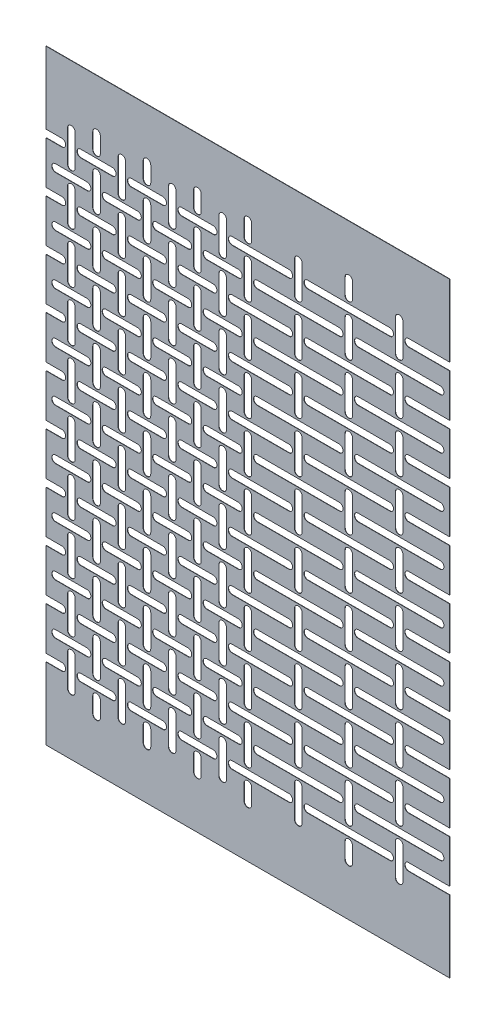
from build123d import *

# Parameters (mm, degrees)
BOSS_EXTRUDE1_DEPTH = 0.127


with BuildPart() as part:
    # Model → Boss-Extrude1 (new body)
    with BuildSketch(Plane.XY):
        with BuildLine():
            Line((0, 31.5), (6.25, 31.5))
            ThreePointArc((6.25, 31.5), (7.75, 30), (6.25, 28.5))
            Line((6.25, 28.5), (0, 28.5))
            Line((0, 28.5), (0, 0))
            Line((0, 0), (80, 0))
            Line((80, 0), (160, 0))
            Line((160, 0), (160, 28.5))
            Line((160, 28.5), (143.75, 28.5))
            ThreePointArc((143.75, 28.5), (142.25, 30), (143.75, 31.5))
            Line((143.75, 31.5), (160, 31.5))
            Line((160, 31.5), (160, 48.5))
            Line((160, 48.5), (143.75, 48.5))
            ThreePointArc((143.75, 48.5), (142.25, 50), (143.75, 51.5))
            Line((143.75, 51.5), (160, 51.5))
            Line((160, 51.5), (160, 68.5))
            Line((160, 68.5), (143.75, 68.5))
            ThreePointArc((143.75, 68.5), (142.25, 70), (143.75, 71.5))
            Line((143.75, 71.5), (160, 71.5))
            Line((160, 71.5), (160, 88.5))
            Line((160, 88.5), (143.75, 88.5))
            ThreePointArc((143.75, 88.5), (142.25, 90), (143.75, 91.5))
            Line((143.75, 91.5), (160, 91.5))
            Line((160, 91.5), (160, 108.5))
            Line((160, 108.5), (143.75, 108.5))
            ThreePointArc((143.75, 108.5), (142.25, 110), (143.75, 111.5))
            Line((143.75, 111.5), (160, 111.5))
            Line((160, 111.5), (160, 128.5))
            Line((160, 128.5), (143.75, 128.5))
            ThreePointArc((143.75, 128.5), (142.25, 130), (143.75, 131.5))
            Line((143.75, 131.5), (160, 131.5))
            Line((160, 131.5), (160, 148.5))
            Line((160, 148.5), (143.75, 148.5))
            ThreePointArc((143.75, 148.5), (142.25, 150), (143.75, 151.5))
            Line((143.75, 151.5), (160, 151.5))
            Line((160, 151.5), (160, 168.5))
            Line((160, 168.5), (143.75, 168.5))
            ThreePointArc((143.75, 168.5), (142.25, 170), (143.75, 171.5))
            Line((143.75, 171.5), (160, 171.5))
            Line((160, 171.5), (160, 188.5))
            Line((160, 188.5), (143.75, 188.5))
            ThreePointArc((143.75, 188.5), (142.25, 190), (143.75, 191.5))
            Line((143.75, 191.5), (160, 191.5))
            Line((160, 191.5), (160, 208.5))
            Line((160, 208.5), (143.75, 208.5))
            ThreePointArc((143.75, 208.5), (142.25, 210), (143.75, 211.5))
            Line((143.75, 211.5), (160, 211.5))
            Line((160, 211.5), (160, 240))
            Line((160, 240), (80, 240))
            Line((80, 240), (0, 240))
            Line((0, 240), (0, 211.5))
            Line((0, 211.5), (6.25, 211.5))
            ThreePointArc((6.25, 211.5), (7.75, 210), (6.25, 208.5))
            Line((6.25, 208.5), (0, 208.5))
            Line((0, 208.5), (0, 191.5))
            Line((0, 191.5), (6.25, 191.5))
            ThreePointArc((6.25, 191.5), (7.75, 190), (6.25, 188.5))
            Line((6.25, 188.5), (0, 188.5))
            Line((0, 188.5), (0, 171.5))
            Line((0, 171.5), (6.25, 171.5))
            ThreePointArc((6.25, 171.5), (7.75, 170), (6.25, 168.5))
            Line((6.25, 168.5), (0, 168.5))
            Line((0, 168.5), (0, 151.5))
            Line((0, 151.5), (6.25, 151.5))
            ThreePointArc((6.25, 151.5), (7.75, 150), (6.25, 148.5))
            Line((6.25, 148.5), (0, 148.5))
            Line((0, 148.5), (0, 131.5))
            Line((0, 131.5), (6.25, 131.5))
            ThreePointArc((6.25, 131.5), (7.75, 130), (6.25, 128.5))
            Line((6.25, 128.5), (0, 128.5))
            Line((0, 128.5), (0, 111.5))
            Line((0, 111.5), (6.25, 111.5))
            ThreePointArc((6.25, 111.5), (7.75, 110), (6.25, 108.5))
            Line((6.25, 108.5), (0, 108.5))
            Line((0, 108.5), (0, 91.5))
            Line((0, 91.5), (6.25, 91.5))
            ThreePointArc((6.25, 91.5), (7.75, 90), (6.25, 88.5))
            Line((6.25, 88.5), (0, 88.5))
            Line((0, 88.5), (0, 71.5))
            Line((0, 71.5), (6.25, 71.5))
            ThreePointArc((6.25, 71.5), (7.75, 70), (6.25, 68.5))
            Line((6.25, 68.5), (0, 68.5))
            Line((0, 68.5), (0, 51.5))
            Line((0, 51.5), (6.25, 51.5))
            ThreePointArc((6.25, 51.5), (7.75, 50), (6.25, 48.5))
            Line((6.25, 48.5), (0, 48.5))
            Line((0, 48.5), (0, 31.5))
        make_face()
        with BuildLine():
            Line((13.75, 31.5), (26.25, 31.5))
            ThreePointArc((26.25, 31.5), (27.75, 30), (26.25, 28.5))
            Line((26.25, 28.5), (13.75, 28.5))
            ThreePointArc((13.75, 28.5), (12.25, 30), (13.75, 31.5))
        make_face(mode=Mode.SUBTRACT)
        with BuildLine():
            Line((33.75, 31.5), (46.25, 31.5))
            ThreePointArc((46.25, 31.5), (47.75, 30), (46.25, 28.5))
            Line((46.25, 28.5), (33.75, 28.5))
            ThreePointArc((33.75, 28.5), (32.25, 30), (33.75, 31.5))
        make_face(mode=Mode.SUBTRACT)
        with BuildLine():
            Line((53.75, 31.5), (66.25, 31.5))
            ThreePointArc((66.25, 31.5), (67.75, 30), (66.25, 28.5))
            Line((66.25, 28.5), (53.75, 28.5))
            ThreePointArc((53.75, 28.5), (52.25, 30), (53.75, 31.5))
        make_face(mode=Mode.SUBTRACT)
        with BuildLine():
            Line((73.75, 31.5), (80, 31.5))
            Line((80, 31.5), (96.25, 31.5))
            ThreePointArc((96.25, 31.5), (97.75, 30), (96.25, 28.5))
            Line((96.25, 28.5), (80, 28.5))
            Line((80, 28.5), (73.75, 28.5))
            ThreePointArc((73.75, 28.5), (72.25, 30), (73.75, 31.5))
        make_face(mode=Mode.SUBTRACT)
        with BuildLine():
            Line((3.75, 41.5), (16.25, 41.5))
            ThreePointArc((16.25, 41.5), (17.75, 40), (16.25, 38.5))
            Line((16.25, 38.5), (3.75, 38.5))
            ThreePointArc((3.75, 38.5), (2.25, 40), (3.75, 41.5))
        make_face(mode=Mode.SUBTRACT)
        with BuildLine():
            Line((23.75, 41.5), (36.25, 41.5))
            ThreePointArc((36.25, 41.5), (37.75, 40), (36.25, 38.5))
            Line((36.25, 38.5), (23.75, 38.5))
            ThreePointArc((23.75, 38.5), (22.25, 40), (23.75, 41.5))
        make_face(mode=Mode.SUBTRACT)
        with BuildLine():
            Line((43.75, 41.5), (56.25, 41.5))
            ThreePointArc((56.25, 41.5), (57.75, 40), (56.25, 38.5))
            Line((56.25, 38.5), (43.75, 38.5))
            ThreePointArc((43.75, 38.5), (42.25, 40), (43.75, 41.5))
        make_face(mode=Mode.SUBTRACT)
        with BuildLine():
            Line((63.75, 41.5), (76.25, 41.5))
            ThreePointArc((76.25, 41.5), (77.75, 40), (76.25, 38.5))
            Line((76.25, 38.5), (63.75, 38.5))
            ThreePointArc((63.75, 38.5), (62.25, 40), (63.75, 41.5))
        make_face(mode=Mode.SUBTRACT)
        with BuildLine():
            Line((13.75, 51.5), (26.25, 51.5))
            ThreePointArc((26.25, 51.5), (27.75, 50), (26.25, 48.5))
            Line((26.25, 48.5), (13.75, 48.5))
            ThreePointArc((13.75, 48.5), (12.25, 50), (13.75, 51.5))
        make_face(mode=Mode.SUBTRACT)
        with BuildLine():
            Line((33.75, 51.5), (46.25, 51.5))
            ThreePointArc((46.25, 51.5), (47.75, 50), (46.25, 48.5))
            Line((46.25, 48.5), (33.75, 48.5))
            ThreePointArc((33.75, 48.5), (32.25, 50), (33.75, 51.5))
        make_face(mode=Mode.SUBTRACT)
        with BuildLine():
            Line((53.75, 51.5), (66.25, 51.5))
            ThreePointArc((66.25, 51.5), (67.75, 50), (66.25, 48.5))
            Line((66.25, 48.5), (53.75, 48.5))
            ThreePointArc((53.75, 48.5), (52.25, 50), (53.75, 51.5))
        make_face(mode=Mode.SUBTRACT)
        with BuildLine():
            Line((73.75, 51.5), (80, 51.5))
            Line((80, 51.5), (96.25, 51.5))
            ThreePointArc((96.25, 51.5), (97.75, 50), (96.25, 48.5))
            Line((96.25, 48.5), (80, 48.5))
            Line((80, 48.5), (73.75, 48.5))
            ThreePointArc((73.75, 48.5), (72.25, 50), (73.75, 51.5))
        make_face(mode=Mode.SUBTRACT)
        with BuildLine():
            Line((3.75, 61.5), (16.25, 61.5))
            ThreePointArc((16.25, 61.5), (17.75, 60), (16.25, 58.5))
            Line((16.25, 58.5), (3.75, 58.5))
            ThreePointArc((3.75, 58.5), (2.25, 60), (3.75, 61.5))
        make_face(mode=Mode.SUBTRACT)
        with BuildLine():
            Line((23.75, 61.5), (36.25, 61.5))
            ThreePointArc((36.25, 61.5), (37.75, 60), (36.25, 58.5))
            Line((36.25, 58.5), (23.75, 58.5))
            ThreePointArc((23.75, 58.5), (22.25, 60), (23.75, 61.5))
        make_face(mode=Mode.SUBTRACT)
        with BuildLine():
            Line((43.75, 61.5), (56.25, 61.5))
            ThreePointArc((56.25, 61.5), (57.75, 60), (56.25, 58.5))
            Line((56.25, 58.5), (43.75, 58.5))
            ThreePointArc((43.75, 58.5), (42.25, 60), (43.75, 61.5))
        make_face(mode=Mode.SUBTRACT)
        with BuildLine():
            Line((63.75, 61.5), (76.25, 61.5))
            ThreePointArc((76.25, 61.5), (77.75, 60), (76.25, 58.5))
            Line((76.25, 58.5), (63.75, 58.5))
            ThreePointArc((63.75, 58.5), (62.25, 60), (63.75, 61.5))
        make_face(mode=Mode.SUBTRACT)
        with BuildLine():
            Line((13.75, 71.5), (26.25, 71.5))
            ThreePointArc((26.25, 71.5), (27.75, 70), (26.25, 68.5))
            Line((26.25, 68.5), (13.75, 68.5))
            ThreePointArc((13.75, 68.5), (12.25, 70), (13.75, 71.5))
        make_face(mode=Mode.SUBTRACT)
        with BuildLine():
            Line((33.75, 71.5), (46.25, 71.5))
            ThreePointArc((46.25, 71.5), (47.75, 70), (46.25, 68.5))
            Line((46.25, 68.5), (33.75, 68.5))
            ThreePointArc((33.75, 68.5), (32.25, 70), (33.75, 71.5))
        make_face(mode=Mode.SUBTRACT)
        with BuildLine():
            Line((53.75, 71.5), (66.25, 71.5))
            ThreePointArc((66.25, 71.5), (67.75, 70), (66.25, 68.5))
            Line((66.25, 68.5), (53.75, 68.5))
            ThreePointArc((53.75, 68.5), (52.25, 70), (53.75, 71.5))
        make_face(mode=Mode.SUBTRACT)
        with BuildLine():
            Line((73.75, 71.5), (80, 71.5))
            Line((80, 71.5), (96.25, 71.5))
            ThreePointArc((96.25, 71.5), (97.75, 70), (96.25, 68.5))
            Line((96.25, 68.5), (80, 68.5))
            Line((80, 68.5), (73.75, 68.5))
            ThreePointArc((73.75, 68.5), (72.25, 70), (73.75, 71.5))
        make_face(mode=Mode.SUBTRACT)
        with BuildLine():
            Line((3.75, 81.5), (16.25, 81.5))
            ThreePointArc((16.25, 81.5), (17.75, 80), (16.25, 78.5))
            Line((16.25, 78.5), (3.75, 78.5))
            ThreePointArc((3.75, 78.5), (2.25, 80), (3.75, 81.5))
        make_face(mode=Mode.SUBTRACT)
        with BuildLine():
            Line((23.75, 81.5), (36.25, 81.5))
            ThreePointArc((36.25, 81.5), (37.75, 80), (36.25, 78.5))
            Line((36.25, 78.5), (23.75, 78.5))
            ThreePointArc((23.75, 78.5), (22.25, 80), (23.75, 81.5))
        make_face(mode=Mode.SUBTRACT)
        with BuildLine():
            Line((43.75, 81.5), (56.25, 81.5))
            ThreePointArc((56.25, 81.5), (57.75, 80), (56.25, 78.5))
            Line((56.25, 78.5), (43.75, 78.5))
            ThreePointArc((43.75, 78.5), (42.25, 80), (43.75, 81.5))
        make_face(mode=Mode.SUBTRACT)
        with BuildLine():
            Line((63.75, 81.5), (76.25, 81.5))
            ThreePointArc((76.25, 81.5), (77.75, 80), (76.25, 78.5))
            Line((76.25, 78.5), (63.75, 78.5))
            ThreePointArc((63.75, 78.5), (62.25, 80), (63.75, 81.5))
        make_face(mode=Mode.SUBTRACT)
        with BuildLine():
            Line((13.75, 91.5), (26.25, 91.5))
            ThreePointArc((26.25, 91.5), (27.75, 90), (26.25, 88.5))
            Line((26.25, 88.5), (13.75, 88.5))
            ThreePointArc((13.75, 88.5), (12.25, 90), (13.75, 91.5))
        make_face(mode=Mode.SUBTRACT)
        with BuildLine():
            Line((33.75, 91.5), (46.25, 91.5))
            ThreePointArc((46.25, 91.5), (47.75, 90), (46.25, 88.5))
            Line((46.25, 88.5), (33.75, 88.5))
            ThreePointArc((33.75, 88.5), (32.25, 90), (33.75, 91.5))
        make_face(mode=Mode.SUBTRACT)
        with BuildLine():
            Line((53.75, 91.5), (66.25, 91.5))
            ThreePointArc((66.25, 91.5), (67.75, 90), (66.25, 88.5))
            Line((66.25, 88.5), (53.75, 88.5))
            ThreePointArc((53.75, 88.5), (52.25, 90), (53.75, 91.5))
        make_face(mode=Mode.SUBTRACT)
        with BuildLine():
            Line((73.75, 91.5), (80, 91.5))
            Line((80, 91.5), (96.25, 91.5))
            ThreePointArc((96.25, 91.5), (97.75, 90), (96.25, 88.5))
            Line((96.25, 88.5), (80, 88.5))
            Line((80, 88.5), (73.75, 88.5))
            ThreePointArc((73.75, 88.5), (72.25, 90), (73.75, 91.5))
        make_face(mode=Mode.SUBTRACT)
        with BuildLine():
            Line((3.75, 101.5), (16.25, 101.5))
            ThreePointArc((16.25, 101.5), (17.75, 100), (16.25, 98.5))
            Line((16.25, 98.5), (3.75, 98.5))
            ThreePointArc((3.75, 98.5), (2.25, 100), (3.75, 101.5))
        make_face(mode=Mode.SUBTRACT)
        with BuildLine():
            Line((23.75, 101.5), (36.25, 101.5))
            ThreePointArc((36.25, 101.5), (37.75, 100), (36.25, 98.5))
            Line((36.25, 98.5), (23.75, 98.5))
            ThreePointArc((23.75, 98.5), (22.25, 100), (23.75, 101.5))
        make_face(mode=Mode.SUBTRACT)
        with BuildLine():
            Line((43.75, 101.5), (56.25, 101.5))
            ThreePointArc((56.25, 101.5), (57.75, 100), (56.25, 98.5))
            Line((56.25, 98.5), (43.75, 98.5))
            ThreePointArc((43.75, 98.5), (42.25, 100), (43.75, 101.5))
        make_face(mode=Mode.SUBTRACT)
        with BuildLine():
            Line((63.75, 101.5), (76.25, 101.5))
            ThreePointArc((76.25, 101.5), (77.75, 100), (76.25, 98.5))
            Line((76.25, 98.5), (63.75, 98.5))
            ThreePointArc((63.75, 98.5), (62.25, 100), (63.75, 101.5))
        make_face(mode=Mode.SUBTRACT)
        with BuildLine():
            Line((13.75, 111.5), (26.25, 111.5))
            ThreePointArc((26.25, 111.5), (27.75, 110), (26.25, 108.5))
            Line((26.25, 108.5), (13.75, 108.5))
            ThreePointArc((13.75, 108.5), (12.25, 110), (13.75, 111.5))
        make_face(mode=Mode.SUBTRACT)
        with BuildLine():
            Line((33.75, 111.5), (46.25, 111.5))
            ThreePointArc((46.25, 111.5), (47.75, 110), (46.25, 108.5))
            Line((46.25, 108.5), (33.75, 108.5))
            ThreePointArc((33.75, 108.5), (32.25, 110), (33.75, 111.5))
        make_face(mode=Mode.SUBTRACT)
        with BuildLine():
            Line((53.75, 111.5), (66.25, 111.5))
            ThreePointArc((66.25, 111.5), (67.75, 110), (66.25, 108.5))
            Line((66.25, 108.5), (53.75, 108.5))
            ThreePointArc((53.75, 108.5), (52.25, 110), (53.75, 111.5))
        make_face(mode=Mode.SUBTRACT)
        with BuildLine():
            Line((73.75, 111.5), (80, 111.5))
            Line((80, 111.5), (96.25, 111.5))
            ThreePointArc((96.25, 111.5), (97.75, 110), (96.25, 108.5))
            Line((96.25, 108.5), (80, 108.5))
            Line((80, 108.5), (73.75, 108.5))
            ThreePointArc((73.75, 108.5), (72.25, 110), (73.75, 111.5))
        make_face(mode=Mode.SUBTRACT)
        with BuildLine():
            Line((3.75, 121.5), (16.25, 121.5))
            ThreePointArc((16.25, 121.5), (17.75, 120), (16.25, 118.5))
            Line((16.25, 118.5), (3.75, 118.5))
            ThreePointArc((3.75, 118.5), (2.25, 120), (3.75, 121.5))
        make_face(mode=Mode.SUBTRACT)
        with BuildLine():
            Line((23.75, 121.5), (36.25, 121.5))
            ThreePointArc((36.25, 121.5), (37.75, 120), (36.25, 118.5))
            Line((36.25, 118.5), (23.75, 118.5))
            ThreePointArc((23.75, 118.5), (22.25, 120), (23.75, 121.5))
        make_face(mode=Mode.SUBTRACT)
        with BuildLine():
            Line((43.75, 121.5), (56.25, 121.5))
            ThreePointArc((56.25, 121.5), (57.75, 120), (56.25, 118.5))
            Line((56.25, 118.5), (43.75, 118.5))
            ThreePointArc((43.75, 118.5), (42.25, 120), (43.75, 121.5))
        make_face(mode=Mode.SUBTRACT)
        with BuildLine():
            Line((63.75, 121.5), (76.25, 121.5))
            ThreePointArc((76.25, 121.5), (77.75, 120), (76.25, 118.5))
            Line((76.25, 118.5), (63.75, 118.5))
            ThreePointArc((63.75, 118.5), (62.25, 120), (63.75, 121.5))
        make_face(mode=Mode.SUBTRACT)
        with BuildLine():
            Line((13.75, 131.5), (26.25, 131.5))
            ThreePointArc((26.25, 131.5), (27.75, 130), (26.25, 128.5))
            Line((26.25, 128.5), (13.75, 128.5))
            ThreePointArc((13.75, 128.5), (12.25, 130), (13.75, 131.5))
        make_face(mode=Mode.SUBTRACT)
        with BuildLine():
            Line((33.75, 131.5), (46.25, 131.5))
            ThreePointArc((46.25, 131.5), (47.75, 130), (46.25, 128.5))
            Line((46.25, 128.5), (33.75, 128.5))
            ThreePointArc((33.75, 128.5), (32.25, 130), (33.75, 131.5))
        make_face(mode=Mode.SUBTRACT)
        with BuildLine():
            Line((53.75, 131.5), (66.25, 131.5))
            ThreePointArc((66.25, 131.5), (67.75, 130), (66.25, 128.5))
            Line((66.25, 128.5), (53.75, 128.5))
            ThreePointArc((53.75, 128.5), (52.25, 130), (53.75, 131.5))
        make_face(mode=Mode.SUBTRACT)
        with BuildLine():
            Line((73.75, 131.5), (80, 131.5))
            Line((80, 131.5), (96.25, 131.5))
            ThreePointArc((96.25, 131.5), (97.75, 130), (96.25, 128.5))
            Line((96.25, 128.5), (80, 128.5))
            Line((80, 128.5), (73.75, 128.5))
            ThreePointArc((73.75, 128.5), (72.25, 130), (73.75, 131.5))
        make_face(mode=Mode.SUBTRACT)
        with BuildLine():
            Line((3.75, 141.5), (16.25, 141.5))
            ThreePointArc((16.25, 141.5), (17.75, 140), (16.25, 138.5))
            Line((16.25, 138.5), (3.75, 138.5))
            ThreePointArc((3.75, 138.5), (2.25, 140), (3.75, 141.5))
        make_face(mode=Mode.SUBTRACT)
        with BuildLine():
            Line((23.75, 141.5), (36.25, 141.5))
            ThreePointArc((36.25, 141.5), (37.75, 140), (36.25, 138.5))
            Line((36.25, 138.5), (23.75, 138.5))
            ThreePointArc((23.75, 138.5), (22.25, 140), (23.75, 141.5))
        make_face(mode=Mode.SUBTRACT)
        with BuildLine():
            Line((43.75, 141.5), (56.25, 141.5))
            ThreePointArc((56.25, 141.5), (57.75, 140), (56.25, 138.5))
            Line((56.25, 138.5), (43.75, 138.5))
            ThreePointArc((43.75, 138.5), (42.25, 140), (43.75, 141.5))
        make_face(mode=Mode.SUBTRACT)
        with BuildLine():
            Line((63.75, 141.5), (76.25, 141.5))
            ThreePointArc((76.25, 141.5), (77.75, 140), (76.25, 138.5))
            Line((76.25, 138.5), (63.75, 138.5))
            ThreePointArc((63.75, 138.5), (62.25, 140), (63.75, 141.5))
        make_face(mode=Mode.SUBTRACT)
        with BuildLine():
            Line((13.75, 151.5), (26.25, 151.5))
            ThreePointArc((26.25, 151.5), (27.75, 150), (26.25, 148.5))
            Line((26.25, 148.5), (13.75, 148.5))
            ThreePointArc((13.75, 148.5), (12.25, 150), (13.75, 151.5))
        make_face(mode=Mode.SUBTRACT)
        with BuildLine():
            Line((33.75, 151.5), (46.25, 151.5))
            ThreePointArc((46.25, 151.5), (47.75, 150), (46.25, 148.5))
            Line((46.25, 148.5), (33.75, 148.5))
            ThreePointArc((33.75, 148.5), (32.25, 150), (33.75, 151.5))
        make_face(mode=Mode.SUBTRACT)
        with BuildLine():
            Line((53.75, 151.5), (66.25, 151.5))
            ThreePointArc((66.25, 151.5), (67.75, 150), (66.25, 148.5))
            Line((66.25, 148.5), (53.75, 148.5))
            ThreePointArc((53.75, 148.5), (52.25, 150), (53.75, 151.5))
        make_face(mode=Mode.SUBTRACT)
        with BuildLine():
            Line((73.75, 151.5), (80, 151.5))
            Line((80, 151.5), (96.25, 151.5))
            ThreePointArc((96.25, 151.5), (97.75, 150), (96.25, 148.5))
            Line((96.25, 148.5), (80, 148.5))
            Line((80, 148.5), (73.75, 148.5))
            ThreePointArc((73.75, 148.5), (72.25, 150), (73.75, 151.5))
        make_face(mode=Mode.SUBTRACT)
        with BuildLine():
            Line((3.75, 161.5), (16.25, 161.5))
            ThreePointArc((16.25, 161.5), (17.75, 160), (16.25, 158.5))
            Line((16.25, 158.5), (3.75, 158.5))
            ThreePointArc((3.75, 158.5), (2.25, 160), (3.75, 161.5))
        make_face(mode=Mode.SUBTRACT)
        with BuildLine():
            Line((23.75, 161.5), (36.25, 161.5))
            ThreePointArc((36.25, 161.5), (37.75, 160), (36.25, 158.5))
            Line((36.25, 158.5), (23.75, 158.5))
            ThreePointArc((23.75, 158.5), (22.25, 160), (23.75, 161.5))
        make_face(mode=Mode.SUBTRACT)
        with BuildLine():
            Line((43.75, 161.5), (56.25, 161.5))
            ThreePointArc((56.25, 161.5), (57.75, 160), (56.25, 158.5))
            Line((56.25, 158.5), (43.75, 158.5))
            ThreePointArc((43.75, 158.5), (42.25, 160), (43.75, 161.5))
        make_face(mode=Mode.SUBTRACT)
        with BuildLine():
            Line((63.75, 161.5), (76.25, 161.5))
            ThreePointArc((76.25, 161.5), (77.75, 160), (76.25, 158.5))
            Line((76.25, 158.5), (63.75, 158.5))
            ThreePointArc((63.75, 158.5), (62.25, 160), (63.75, 161.5))
        make_face(mode=Mode.SUBTRACT)
        with BuildLine():
            Line((13.75, 171.5), (26.25, 171.5))
            ThreePointArc((26.25, 171.5), (27.75, 170), (26.25, 168.5))
            Line((26.25, 168.5), (13.75, 168.5))
            ThreePointArc((13.75, 168.5), (12.25, 170), (13.75, 171.5))
        make_face(mode=Mode.SUBTRACT)
        with BuildLine():
            Line((33.75, 171.5), (46.25, 171.5))
            ThreePointArc((46.25, 171.5), (47.75, 170), (46.25, 168.5))
            Line((46.25, 168.5), (33.75, 168.5))
            ThreePointArc((33.75, 168.5), (32.25, 170), (33.75, 171.5))
        make_face(mode=Mode.SUBTRACT)
        with BuildLine():
            Line((53.75, 171.5), (66.25, 171.5))
            ThreePointArc((66.25, 171.5), (67.75, 170), (66.25, 168.5))
            Line((66.25, 168.5), (53.75, 168.5))
            ThreePointArc((53.75, 168.5), (52.25, 170), (53.75, 171.5))
        make_face(mode=Mode.SUBTRACT)
        with BuildLine():
            Line((73.75, 171.5), (80, 171.5))
            Line((80, 171.5), (96.25, 171.5))
            ThreePointArc((96.25, 171.5), (97.75, 170), (96.25, 168.5))
            Line((96.25, 168.5), (80, 168.5))
            Line((80, 168.5), (73.75, 168.5))
            ThreePointArc((73.75, 168.5), (72.25, 170), (73.75, 171.5))
        make_face(mode=Mode.SUBTRACT)
        with BuildLine():
            Line((3.75, 181.5), (16.25, 181.5))
            ThreePointArc((16.25, 181.5), (17.75, 180), (16.25, 178.5))
            Line((16.25, 178.5), (3.75, 178.5))
            ThreePointArc((3.75, 178.5), (2.25, 180), (3.75, 181.5))
        make_face(mode=Mode.SUBTRACT)
        with BuildLine():
            Line((23.75, 181.5), (36.25, 181.5))
            ThreePointArc((36.25, 181.5), (37.75, 180), (36.25, 178.5))
            Line((36.25, 178.5), (23.75, 178.5))
            ThreePointArc((23.75, 178.5), (22.25, 180), (23.75, 181.5))
        make_face(mode=Mode.SUBTRACT)
        with BuildLine():
            Line((43.75, 181.5), (56.25, 181.5))
            ThreePointArc((56.25, 181.5), (57.75, 180), (56.25, 178.5))
            Line((56.25, 178.5), (43.75, 178.5))
            ThreePointArc((43.75, 178.5), (42.25, 180), (43.75, 181.5))
        make_face(mode=Mode.SUBTRACT)
        with BuildLine():
            Line((63.75, 181.5), (76.25, 181.5))
            ThreePointArc((76.25, 181.5), (77.75, 180), (76.25, 178.5))
            Line((76.25, 178.5), (63.75, 178.5))
            ThreePointArc((63.75, 178.5), (62.25, 180), (63.75, 181.5))
        make_face(mode=Mode.SUBTRACT)
        with BuildLine():
            Line((13.75, 191.5), (26.25, 191.5))
            ThreePointArc((26.25, 191.5), (27.75, 190), (26.25, 188.5))
            Line((26.25, 188.5), (13.75, 188.5))
            ThreePointArc((13.75, 188.5), (12.25, 190), (13.75, 191.5))
        make_face(mode=Mode.SUBTRACT)
        with BuildLine():
            Line((33.75, 191.5), (46.25, 191.5))
            ThreePointArc((46.25, 191.5), (47.75, 190), (46.25, 188.5))
            Line((46.25, 188.5), (33.75, 188.5))
            ThreePointArc((33.75, 188.5), (32.25, 190), (33.75, 191.5))
        make_face(mode=Mode.SUBTRACT)
        with BuildLine():
            Line((53.75, 191.5), (66.25, 191.5))
            ThreePointArc((66.25, 191.5), (67.75, 190), (66.25, 188.5))
            Line((66.25, 188.5), (53.75, 188.5))
            ThreePointArc((53.75, 188.5), (52.25, 190), (53.75, 191.5))
        make_face(mode=Mode.SUBTRACT)
        with BuildLine():
            Line((73.75, 191.5), (80, 191.5))
            Line((80, 191.5), (96.25, 191.5))
            ThreePointArc((96.25, 191.5), (97.75, 190), (96.25, 188.5))
            Line((96.25, 188.5), (80, 188.5))
            Line((80, 188.5), (73.75, 188.5))
            ThreePointArc((73.75, 188.5), (72.25, 190), (73.75, 191.5))
        make_face(mode=Mode.SUBTRACT)
        with BuildLine():
            Line((3.75, 201.5), (16.25, 201.5))
            ThreePointArc((16.25, 201.5), (17.75, 200), (16.25, 198.5))
            Line((16.25, 198.5), (3.75, 198.5))
            ThreePointArc((3.75, 198.5), (2.25, 200), (3.75, 201.5))
        make_face(mode=Mode.SUBTRACT)
        with BuildLine():
            Line((23.75, 201.5), (36.25, 201.5))
            ThreePointArc((36.25, 201.5), (37.75, 200), (36.25, 198.5))
            Line((36.25, 198.5), (23.75, 198.5))
            ThreePointArc((23.75, 198.5), (22.25, 200), (23.75, 201.5))
        make_face(mode=Mode.SUBTRACT)
        with BuildLine():
            Line((43.75, 201.5), (56.25, 201.5))
            ThreePointArc((56.25, 201.5), (57.75, 200), (56.25, 198.5))
            Line((56.25, 198.5), (43.75, 198.5))
            ThreePointArc((43.75, 198.5), (42.25, 200), (43.75, 201.5))
        make_face(mode=Mode.SUBTRACT)
        with BuildLine():
            Line((63.75, 201.5), (76.25, 201.5))
            ThreePointArc((76.25, 201.5), (77.75, 200), (76.25, 198.5))
            Line((76.25, 198.5), (63.75, 198.5))
            ThreePointArc((63.75, 198.5), (62.25, 200), (63.75, 201.5))
        make_face(mode=Mode.SUBTRACT)
        with BuildLine():
            Line((13.75, 211.5), (26.25, 211.5))
            ThreePointArc((26.25, 211.5), (27.75, 210), (26.25, 208.5))
            Line((26.25, 208.5), (13.75, 208.5))
            ThreePointArc((13.75, 208.5), (12.25, 210), (13.75, 211.5))
        make_face(mode=Mode.SUBTRACT)
        with BuildLine():
            Line((33.75, 211.5), (46.25, 211.5))
            ThreePointArc((46.25, 211.5), (47.75, 210), (46.25, 208.5))
            Line((46.25, 208.5), (33.75, 208.5))
            ThreePointArc((33.75, 208.5), (32.25, 210), (33.75, 211.5))
        make_face(mode=Mode.SUBTRACT)
        with BuildLine():
            Line((53.75, 211.5), (66.25, 211.5))
            ThreePointArc((66.25, 211.5), (67.75, 210), (66.25, 208.5))
            Line((66.25, 208.5), (53.75, 208.5))
            ThreePointArc((53.75, 208.5), (52.25, 210), (53.75, 211.5))
        make_face(mode=Mode.SUBTRACT)
        with BuildLine():
            Line((73.75, 211.5), (80, 211.5))
            Line((80, 211.5), (96.25, 211.5))
            ThreePointArc((96.25, 211.5), (97.75, 210), (96.25, 208.5))
            Line((96.25, 208.5), (80, 208.5))
            Line((80, 208.5), (73.75, 208.5))
            ThreePointArc((73.75, 208.5), (72.25, 210), (73.75, 211.5))
        make_face(mode=Mode.SUBTRACT)
        with BuildLine():
            Line((11.5, 23.75), (11.5, 36.25))
            ThreePointArc((11.5, 36.25), (10, 37.75), (8.5, 36.25))
            Line((8.5, 36.25), (8.5, 23.75))
            ThreePointArc((8.5, 23.75), (10, 22.25), (11.5, 23.75))
        make_face(mode=Mode.SUBTRACT)
        with BuildLine():
            Line((11.5, 43.75), (11.5, 56.25))
            ThreePointArc((11.5, 56.25), (10, 57.75), (8.5, 56.25))
            Line((8.5, 56.25), (8.5, 43.75))
            ThreePointArc((8.5, 43.75), (10, 42.25), (11.5, 43.75))
        make_face(mode=Mode.SUBTRACT)
        with BuildLine():
            Line((11.5, 63.75), (11.5, 76.25))
            ThreePointArc((11.5, 76.25), (10, 77.75), (8.5, 76.25))
            Line((8.5, 76.25), (8.5, 63.75))
            ThreePointArc((8.5, 63.75), (10, 62.25), (11.5, 63.75))
        make_face(mode=Mode.SUBTRACT)
        with BuildLine():
            Line((11.5, 83.75), (11.5, 96.25))
            ThreePointArc((11.5, 96.25), (10, 97.75), (8.5, 96.25))
            Line((8.5, 96.25), (8.5, 83.75))
            ThreePointArc((8.5, 83.75), (10, 82.25), (11.5, 83.75))
        make_face(mode=Mode.SUBTRACT)
        with BuildLine():
            Line((11.5, 103.75), (11.5, 116.25))
            ThreePointArc((11.5, 116.25), (10, 117.75), (8.5, 116.25))
            Line((8.5, 116.25), (8.5, 103.75))
            ThreePointArc((8.5, 103.75), (10, 102.25), (11.5, 103.75))
        make_face(mode=Mode.SUBTRACT)
        with BuildLine():
            Line((11.5, 123.75), (11.5, 136.25))
            ThreePointArc((11.5, 136.25), (10, 137.75), (8.5, 136.25))
            Line((8.5, 136.25), (8.5, 123.75))
            ThreePointArc((8.5, 123.75), (10, 122.25), (11.5, 123.75))
        make_face(mode=Mode.SUBTRACT)
        with BuildLine():
            Line((11.5, 143.75), (11.5, 156.25))
            ThreePointArc((11.5, 156.25), (10, 157.75), (8.5, 156.25))
            Line((8.5, 156.25), (8.5, 143.75))
            ThreePointArc((8.5, 143.75), (10, 142.25), (11.5, 143.75))
        make_face(mode=Mode.SUBTRACT)
        with BuildLine():
            Line((11.5, 163.75), (11.5, 176.25))
            ThreePointArc((11.5, 176.25), (10, 177.75), (8.5, 176.25))
            Line((8.5, 176.25), (8.5, 163.75))
            ThreePointArc((8.5, 163.75), (10, 162.25), (11.5, 163.75))
        make_face(mode=Mode.SUBTRACT)
        with BuildLine():
            Line((11.5, 183.75), (11.5, 196.25))
            ThreePointArc((11.5, 196.25), (10, 197.75), (8.5, 196.25))
            Line((8.5, 196.25), (8.5, 183.75))
            ThreePointArc((8.5, 183.75), (10, 182.25), (11.5, 183.75))
        make_face(mode=Mode.SUBTRACT)
        with BuildLine():
            Line((11.5, 203.75), (11.5, 216.25))
            ThreePointArc((11.5, 216.25), (10, 217.75), (8.5, 216.25))
            Line((8.5, 216.25), (8.5, 203.75))
            ThreePointArc((8.5, 203.75), (10, 202.25), (11.5, 203.75))
        make_face(mode=Mode.SUBTRACT)
        with BuildLine():
            Line((21.5, 20), (21.5, 26.25))
            ThreePointArc((21.5, 26.25), (20, 27.75), (18.5, 26.25))
            Line((18.5, 26.25), (18.5, 20))
            ThreePointArc((18.5, 20), (20, 18.5), (21.5, 20))
        make_face(mode=Mode.SUBTRACT)
        with BuildLine():
            Line((21.5, 33.75), (21.5, 46.25))
            ThreePointArc((21.5, 46.25), (20, 47.75), (18.5, 46.25))
            Line((18.5, 46.25), (18.5, 33.75))
            ThreePointArc((18.5, 33.75), (20, 32.25), (21.5, 33.75))
        make_face(mode=Mode.SUBTRACT)
        with BuildLine():
            Line((21.5, 53.75), (21.5, 66.25))
            ThreePointArc((21.5, 66.25), (20, 67.75), (18.5, 66.25))
            Line((18.5, 66.25), (18.5, 53.75))
            ThreePointArc((18.5, 53.75), (20, 52.25), (21.5, 53.75))
        make_face(mode=Mode.SUBTRACT)
        with BuildLine():
            Line((21.5, 73.75), (21.5, 86.25))
            ThreePointArc((21.5, 86.25), (20, 87.75), (18.5, 86.25))
            Line((18.5, 86.25), (18.5, 73.75))
            ThreePointArc((18.5, 73.75), (20, 72.25), (21.5, 73.75))
        make_face(mode=Mode.SUBTRACT)
        with BuildLine():
            Line((21.5, 93.75), (21.5, 106.25))
            ThreePointArc((21.5, 106.25), (20, 107.75), (18.5, 106.25))
            Line((18.5, 106.25), (18.5, 93.75))
            ThreePointArc((18.5, 93.75), (20, 92.25), (21.5, 93.75))
        make_face(mode=Mode.SUBTRACT)
        with BuildLine():
            Line((21.5, 113.75), (21.5, 126.25))
            ThreePointArc((21.5, 126.25), (20, 127.75), (18.5, 126.25))
            Line((18.5, 126.25), (18.5, 113.75))
            ThreePointArc((18.5, 113.75), (20, 112.25), (21.5, 113.75))
        make_face(mode=Mode.SUBTRACT)
        with BuildLine():
            Line((21.5, 133.75), (21.5, 146.25))
            ThreePointArc((21.5, 146.25), (20, 147.75), (18.5, 146.25))
            Line((18.5, 146.25), (18.5, 133.75))
            ThreePointArc((18.5, 133.75), (20, 132.25), (21.5, 133.75))
        make_face(mode=Mode.SUBTRACT)
        with BuildLine():
            Line((21.5, 153.75), (21.5, 166.25))
            ThreePointArc((21.5, 166.25), (20, 167.75), (18.5, 166.25))
            Line((18.5, 166.25), (18.5, 153.75))
            ThreePointArc((18.5, 153.75), (20, 152.25), (21.5, 153.75))
        make_face(mode=Mode.SUBTRACT)
        with BuildLine():
            Line((21.5, 173.75), (21.5, 186.25))
            ThreePointArc((21.5, 186.25), (20, 187.75), (18.5, 186.25))
            Line((18.5, 186.25), (18.5, 173.75))
            ThreePointArc((18.5, 173.75), (20, 172.25), (21.5, 173.75))
        make_face(mode=Mode.SUBTRACT)
        with BuildLine():
            Line((21.5, 193.75), (21.5, 206.25))
            ThreePointArc((21.5, 206.25), (20, 207.75), (18.5, 206.25))
            Line((18.5, 206.25), (18.5, 193.75))
            ThreePointArc((18.5, 193.75), (20, 192.25), (21.5, 193.75))
        make_face(mode=Mode.SUBTRACT)
        with BuildLine():
            Line((21.5, 213.75), (21.5, 220))
            ThreePointArc((21.5, 220), (20, 221.5), (18.5, 220))
            Line((18.5, 220), (18.5, 213.75))
            ThreePointArc((18.5, 213.75), (20, 212.25), (21.5, 213.75))
        make_face(mode=Mode.SUBTRACT)
        with BuildLine():
            Line((31.5, 23.75), (31.5, 36.25))
            ThreePointArc((31.5, 36.25), (30, 37.75), (28.5, 36.25))
            Line((28.5, 36.25), (28.5, 23.75))
            ThreePointArc((28.5, 23.75), (30, 22.25), (31.5, 23.75))
        make_face(mode=Mode.SUBTRACT)
        with BuildLine():
            Line((31.5, 43.75), (31.5, 56.25))
            ThreePointArc((31.5, 56.25), (30, 57.75), (28.5, 56.25))
            Line((28.5, 56.25), (28.5, 43.75))
            ThreePointArc((28.5, 43.75), (30, 42.25), (31.5, 43.75))
        make_face(mode=Mode.SUBTRACT)
        with BuildLine():
            Line((31.5, 63.75), (31.5, 76.25))
            ThreePointArc((31.5, 76.25), (30, 77.75), (28.5, 76.25))
            Line((28.5, 76.25), (28.5, 63.75))
            ThreePointArc((28.5, 63.75), (30, 62.25), (31.5, 63.75))
        make_face(mode=Mode.SUBTRACT)
        with BuildLine():
            Line((31.5, 83.75), (31.5, 96.25))
            ThreePointArc((31.5, 96.25), (30, 97.75), (28.5, 96.25))
            Line((28.5, 96.25), (28.5, 83.75))
            ThreePointArc((28.5, 83.75), (30, 82.25), (31.5, 83.75))
        make_face(mode=Mode.SUBTRACT)
        with BuildLine():
            Line((31.5, 103.75), (31.5, 116.25))
            ThreePointArc((31.5, 116.25), (30, 117.75), (28.5, 116.25))
            Line((28.5, 116.25), (28.5, 103.75))
            ThreePointArc((28.5, 103.75), (30, 102.25), (31.5, 103.75))
        make_face(mode=Mode.SUBTRACT)
        with BuildLine():
            Line((31.5, 123.75), (31.5, 136.25))
            ThreePointArc((31.5, 136.25), (30, 137.75), (28.5, 136.25))
            Line((28.5, 136.25), (28.5, 123.75))
            ThreePointArc((28.5, 123.75), (30, 122.25), (31.5, 123.75))
        make_face(mode=Mode.SUBTRACT)
        with BuildLine():
            Line((31.5, 143.75), (31.5, 156.25))
            ThreePointArc((31.5, 156.25), (30, 157.75), (28.5, 156.25))
            Line((28.5, 156.25), (28.5, 143.75))
            ThreePointArc((28.5, 143.75), (30, 142.25), (31.5, 143.75))
        make_face(mode=Mode.SUBTRACT)
        with BuildLine():
            Line((31.5, 163.75), (31.5, 176.25))
            ThreePointArc((31.5, 176.25), (30, 177.75), (28.5, 176.25))
            Line((28.5, 176.25), (28.5, 163.75))
            ThreePointArc((28.5, 163.75), (30, 162.25), (31.5, 163.75))
        make_face(mode=Mode.SUBTRACT)
        with BuildLine():
            Line((31.5, 183.75), (31.5, 196.25))
            ThreePointArc((31.5, 196.25), (30, 197.75), (28.5, 196.25))
            Line((28.5, 196.25), (28.5, 183.75))
            ThreePointArc((28.5, 183.75), (30, 182.25), (31.5, 183.75))
        make_face(mode=Mode.SUBTRACT)
        with BuildLine():
            Line((31.5, 203.75), (31.5, 216.25))
            ThreePointArc((31.5, 216.25), (30, 217.75), (28.5, 216.25))
            Line((28.5, 216.25), (28.5, 203.75))
            ThreePointArc((28.5, 203.75), (30, 202.25), (31.5, 203.75))
        make_face(mode=Mode.SUBTRACT)
        with BuildLine():
            Line((41.5, 20), (41.5, 26.25))
            ThreePointArc((41.5, 26.25), (40, 27.75), (38.5, 26.25))
            Line((38.5, 26.25), (38.5, 20))
            ThreePointArc((38.5, 20), (40, 18.5), (41.5, 20))
        make_face(mode=Mode.SUBTRACT)
        with BuildLine():
            Line((41.5, 33.75), (41.5, 46.25))
            ThreePointArc((41.5, 46.25), (40, 47.75), (38.5, 46.25))
            Line((38.5, 46.25), (38.5, 33.75))
            ThreePointArc((38.5, 33.75), (40, 32.25), (41.5, 33.75))
        make_face(mode=Mode.SUBTRACT)
        with BuildLine():
            Line((41.5, 53.75), (41.5, 66.25))
            ThreePointArc((41.5, 66.25), (40, 67.75), (38.5, 66.25))
            Line((38.5, 66.25), (38.5, 53.75))
            ThreePointArc((38.5, 53.75), (40, 52.25), (41.5, 53.75))
        make_face(mode=Mode.SUBTRACT)
        with BuildLine():
            Line((41.5, 73.75), (41.5, 86.25))
            ThreePointArc((41.5, 86.25), (40, 87.75), (38.5, 86.25))
            Line((38.5, 86.25), (38.5, 73.75))
            ThreePointArc((38.5, 73.75), (40, 72.25), (41.5, 73.75))
        make_face(mode=Mode.SUBTRACT)
        with BuildLine():
            Line((41.5, 93.75), (41.5, 106.25))
            ThreePointArc((41.5, 106.25), (40, 107.75), (38.5, 106.25))
            Line((38.5, 106.25), (38.5, 93.75))
            ThreePointArc((38.5, 93.75), (40, 92.25), (41.5, 93.75))
        make_face(mode=Mode.SUBTRACT)
        with BuildLine():
            Line((41.5, 113.75), (41.5, 126.25))
            ThreePointArc((41.5, 126.25), (40, 127.75), (38.5, 126.25))
            Line((38.5, 126.25), (38.5, 113.75))
            ThreePointArc((38.5, 113.75), (40, 112.25), (41.5, 113.75))
        make_face(mode=Mode.SUBTRACT)
        with BuildLine():
            Line((41.5, 133.75), (41.5, 146.25))
            ThreePointArc((41.5, 146.25), (40, 147.75), (38.5, 146.25))
            Line((38.5, 146.25), (38.5, 133.75))
            ThreePointArc((38.5, 133.75), (40, 132.25), (41.5, 133.75))
        make_face(mode=Mode.SUBTRACT)
        with BuildLine():
            Line((41.5, 153.75), (41.5, 166.25))
            ThreePointArc((41.5, 166.25), (40, 167.75), (38.5, 166.25))
            Line((38.5, 166.25), (38.5, 153.75))
            ThreePointArc((38.5, 153.75), (40, 152.25), (41.5, 153.75))
        make_face(mode=Mode.SUBTRACT)
        with BuildLine():
            Line((41.5, 173.75), (41.5, 186.25))
            ThreePointArc((41.5, 186.25), (40, 187.75), (38.5, 186.25))
            Line((38.5, 186.25), (38.5, 173.75))
            ThreePointArc((38.5, 173.75), (40, 172.25), (41.5, 173.75))
        make_face(mode=Mode.SUBTRACT)
        with BuildLine():
            Line((41.5, 193.75), (41.5, 206.25))
            ThreePointArc((41.5, 206.25), (40, 207.75), (38.5, 206.25))
            Line((38.5, 206.25), (38.5, 193.75))
            ThreePointArc((38.5, 193.75), (40, 192.25), (41.5, 193.75))
        make_face(mode=Mode.SUBTRACT)
        with BuildLine():
            Line((41.5, 213.75), (41.5, 220))
            ThreePointArc((41.5, 220), (40, 221.5), (38.5, 220))
            Line((38.5, 220), (38.5, 213.75))
            ThreePointArc((38.5, 213.75), (40, 212.25), (41.5, 213.75))
        make_face(mode=Mode.SUBTRACT)
        with BuildLine():
            Line((51.5, 23.75), (51.5, 36.25))
            ThreePointArc((51.5, 36.25), (50, 37.75), (48.5, 36.25))
            Line((48.5, 36.25), (48.5, 23.75))
            ThreePointArc((48.5, 23.75), (50, 22.25), (51.5, 23.75))
        make_face(mode=Mode.SUBTRACT)
        with BuildLine():
            Line((51.5, 43.75), (51.5, 56.25))
            ThreePointArc((51.5, 56.25), (50, 57.75), (48.5, 56.25))
            Line((48.5, 56.25), (48.5, 43.75))
            ThreePointArc((48.5, 43.75), (50, 42.25), (51.5, 43.75))
        make_face(mode=Mode.SUBTRACT)
        with BuildLine():
            Line((51.5, 63.75), (51.5, 76.25))
            ThreePointArc((51.5, 76.25), (50, 77.75), (48.5, 76.25))
            Line((48.5, 76.25), (48.5, 63.75))
            ThreePointArc((48.5, 63.75), (50, 62.25), (51.5, 63.75))
        make_face(mode=Mode.SUBTRACT)
        with BuildLine():
            Line((51.5, 83.75), (51.5, 96.25))
            ThreePointArc((51.5, 96.25), (50, 97.75), (48.5, 96.25))
            Line((48.5, 96.25), (48.5, 83.75))
            ThreePointArc((48.5, 83.75), (50, 82.25), (51.5, 83.75))
        make_face(mode=Mode.SUBTRACT)
        with BuildLine():
            Line((51.5, 103.75), (51.5, 116.25))
            ThreePointArc((51.5, 116.25), (50, 117.75), (48.5, 116.25))
            Line((48.5, 116.25), (48.5, 103.75))
            ThreePointArc((48.5, 103.75), (50, 102.25), (51.5, 103.75))
        make_face(mode=Mode.SUBTRACT)
        with BuildLine():
            Line((51.5, 123.75), (51.5, 136.25))
            ThreePointArc((51.5, 136.25), (50, 137.75), (48.5, 136.25))
            Line((48.5, 136.25), (48.5, 123.75))
            ThreePointArc((48.5, 123.75), (50, 122.25), (51.5, 123.75))
        make_face(mode=Mode.SUBTRACT)
        with BuildLine():
            Line((51.5, 143.75), (51.5, 156.25))
            ThreePointArc((51.5, 156.25), (50, 157.75), (48.5, 156.25))
            Line((48.5, 156.25), (48.5, 143.75))
            ThreePointArc((48.5, 143.75), (50, 142.25), (51.5, 143.75))
        make_face(mode=Mode.SUBTRACT)
        with BuildLine():
            Line((51.5, 163.75), (51.5, 176.25))
            ThreePointArc((51.5, 176.25), (50, 177.75), (48.5, 176.25))
            Line((48.5, 176.25), (48.5, 163.75))
            ThreePointArc((48.5, 163.75), (50, 162.25), (51.5, 163.75))
        make_face(mode=Mode.SUBTRACT)
        with BuildLine():
            Line((51.5, 183.75), (51.5, 196.25))
            ThreePointArc((51.5, 196.25), (50, 197.75), (48.5, 196.25))
            Line((48.5, 196.25), (48.5, 183.75))
            ThreePointArc((48.5, 183.75), (50, 182.25), (51.5, 183.75))
        make_face(mode=Mode.SUBTRACT)
        with BuildLine():
            Line((51.5, 203.75), (51.5, 216.25))
            ThreePointArc((51.5, 216.25), (50, 217.75), (48.5, 216.25))
            Line((48.5, 216.25), (48.5, 203.75))
            ThreePointArc((48.5, 203.75), (50, 202.25), (51.5, 203.75))
        make_face(mode=Mode.SUBTRACT)
        with BuildLine():
            Line((61.5, 20), (61.5, 26.25))
            ThreePointArc((61.5, 26.25), (60, 27.75), (58.5, 26.25))
            Line((58.5, 26.25), (58.5, 20))
            ThreePointArc((58.5, 20), (60, 18.5), (61.5, 20))
        make_face(mode=Mode.SUBTRACT)
        with BuildLine():
            Line((61.5, 33.75), (61.5, 46.25))
            ThreePointArc((61.5, 46.25), (60, 47.75), (58.5, 46.25))
            Line((58.5, 46.25), (58.5, 33.75))
            ThreePointArc((58.5, 33.75), (60, 32.25), (61.5, 33.75))
        make_face(mode=Mode.SUBTRACT)
        with BuildLine():
            Line((61.5, 53.75), (61.5, 66.25))
            ThreePointArc((61.5, 66.25), (60, 67.75), (58.5, 66.25))
            Line((58.5, 66.25), (58.5, 53.75))
            ThreePointArc((58.5, 53.75), (60, 52.25), (61.5, 53.75))
        make_face(mode=Mode.SUBTRACT)
        with BuildLine():
            Line((61.5, 73.75), (61.5, 86.25))
            ThreePointArc((61.5, 86.25), (60, 87.75), (58.5, 86.25))
            Line((58.5, 86.25), (58.5, 73.75))
            ThreePointArc((58.5, 73.75), (60, 72.25), (61.5, 73.75))
        make_face(mode=Mode.SUBTRACT)
        with BuildLine():
            Line((61.5, 93.75), (61.5, 106.25))
            ThreePointArc((61.5, 106.25), (60, 107.75), (58.5, 106.25))
            Line((58.5, 106.25), (58.5, 93.75))
            ThreePointArc((58.5, 93.75), (60, 92.25), (61.5, 93.75))
        make_face(mode=Mode.SUBTRACT)
        with BuildLine():
            Line((61.5, 113.75), (61.5, 126.25))
            ThreePointArc((61.5, 126.25), (60, 127.75), (58.5, 126.25))
            Line((58.5, 126.25), (58.5, 113.75))
            ThreePointArc((58.5, 113.75), (60, 112.25), (61.5, 113.75))
        make_face(mode=Mode.SUBTRACT)
        with BuildLine():
            Line((61.5, 133.75), (61.5, 146.25))
            ThreePointArc((61.5, 146.25), (60, 147.75), (58.5, 146.25))
            Line((58.5, 146.25), (58.5, 133.75))
            ThreePointArc((58.5, 133.75), (60, 132.25), (61.5, 133.75))
        make_face(mode=Mode.SUBTRACT)
        with BuildLine():
            Line((61.5, 153.75), (61.5, 166.25))
            ThreePointArc((61.5, 166.25), (60, 167.75), (58.5, 166.25))
            Line((58.5, 166.25), (58.5, 153.75))
            ThreePointArc((58.5, 153.75), (60, 152.25), (61.5, 153.75))
        make_face(mode=Mode.SUBTRACT)
        with BuildLine():
            Line((61.5, 173.75), (61.5, 186.25))
            ThreePointArc((61.5, 186.25), (60, 187.75), (58.5, 186.25))
            Line((58.5, 186.25), (58.5, 173.75))
            ThreePointArc((58.5, 173.75), (60, 172.25), (61.5, 173.75))
        make_face(mode=Mode.SUBTRACT)
        with BuildLine():
            Line((61.5, 193.75), (61.5, 206.25))
            ThreePointArc((61.5, 206.25), (60, 207.75), (58.5, 206.25))
            Line((58.5, 206.25), (58.5, 193.75))
            ThreePointArc((58.5, 193.75), (60, 192.25), (61.5, 193.75))
        make_face(mode=Mode.SUBTRACT)
        with BuildLine():
            Line((61.5, 213.75), (61.5, 220))
            ThreePointArc((61.5, 220), (60, 221.5), (58.5, 220))
            Line((58.5, 220), (58.5, 213.75))
            ThreePointArc((58.5, 213.75), (60, 212.25), (61.5, 213.75))
        make_face(mode=Mode.SUBTRACT)
        with BuildLine():
            Line((71.5, 23.75), (71.5, 36.25))
            ThreePointArc((71.5, 36.25), (70, 37.75), (68.5, 36.25))
            Line((68.5, 36.25), (68.5, 23.75))
            ThreePointArc((68.5, 23.75), (70, 22.25), (71.5, 23.75))
        make_face(mode=Mode.SUBTRACT)
        with BuildLine():
            Line((71.5, 43.75), (71.5, 56.25))
            ThreePointArc((71.5, 56.25), (70, 57.75), (68.5, 56.25))
            Line((68.5, 56.25), (68.5, 43.75))
            ThreePointArc((68.5, 43.75), (70, 42.25), (71.5, 43.75))
        make_face(mode=Mode.SUBTRACT)
        with BuildLine():
            Line((71.5, 63.75), (71.5, 76.25))
            ThreePointArc((71.5, 76.25), (70, 77.75), (68.5, 76.25))
            Line((68.5, 76.25), (68.5, 63.75))
            ThreePointArc((68.5, 63.75), (70, 62.25), (71.5, 63.75))
        make_face(mode=Mode.SUBTRACT)
        with BuildLine():
            Line((71.5, 83.75), (71.5, 96.25))
            ThreePointArc((71.5, 96.25), (70, 97.75), (68.5, 96.25))
            Line((68.5, 96.25), (68.5, 83.75))
            ThreePointArc((68.5, 83.75), (70, 82.25), (71.5, 83.75))
        make_face(mode=Mode.SUBTRACT)
        with BuildLine():
            Line((71.5, 103.75), (71.5, 116.25))
            ThreePointArc((71.5, 116.25), (70, 117.75), (68.5, 116.25))
            Line((68.5, 116.25), (68.5, 103.75))
            ThreePointArc((68.5, 103.75), (70, 102.25), (71.5, 103.75))
        make_face(mode=Mode.SUBTRACT)
        with BuildLine():
            Line((71.5, 123.75), (71.5, 136.25))
            ThreePointArc((71.5, 136.25), (70, 137.75), (68.5, 136.25))
            Line((68.5, 136.25), (68.5, 123.75))
            ThreePointArc((68.5, 123.75), (70, 122.25), (71.5, 123.75))
        make_face(mode=Mode.SUBTRACT)
        with BuildLine():
            Line((71.5, 143.75), (71.5, 156.25))
            ThreePointArc((71.5, 156.25), (70, 157.75), (68.5, 156.25))
            Line((68.5, 156.25), (68.5, 143.75))
            ThreePointArc((68.5, 143.75), (70, 142.25), (71.5, 143.75))
        make_face(mode=Mode.SUBTRACT)
        with BuildLine():
            Line((71.5, 163.75), (71.5, 176.25))
            ThreePointArc((71.5, 176.25), (70, 177.75), (68.5, 176.25))
            Line((68.5, 176.25), (68.5, 163.75))
            ThreePointArc((68.5, 163.75), (70, 162.25), (71.5, 163.75))
        make_face(mode=Mode.SUBTRACT)
        with BuildLine():
            Line((71.5, 183.75), (71.5, 196.25))
            ThreePointArc((71.5, 196.25), (70, 197.75), (68.5, 196.25))
            Line((68.5, 196.25), (68.5, 183.75))
            ThreePointArc((68.5, 183.75), (70, 182.25), (71.5, 183.75))
        make_face(mode=Mode.SUBTRACT)
        with BuildLine():
            Line((71.5, 203.75), (71.5, 216.25))
            ThreePointArc((71.5, 216.25), (70, 217.75), (68.5, 216.25))
            Line((68.5, 216.25), (68.5, 203.75))
            ThreePointArc((68.5, 203.75), (70, 202.25), (71.5, 203.75))
        make_face(mode=Mode.SUBTRACT)
        with BuildLine():
            Line((81.5, 20), (81.5, 26.25))
            ThreePointArc((81.5, 26.25), (80, 27.75), (78.5, 26.25))
            Line((78.5, 26.25), (78.5, 20))
            ThreePointArc((78.5, 20), (80, 18.5), (81.5, 20))
        make_face(mode=Mode.SUBTRACT)
        with BuildLine():
            Line((81.5, 33.75), (81.5, 46.25))
            ThreePointArc((81.5, 46.25), (80, 47.75), (78.5, 46.25))
            Line((78.5, 46.25), (78.5, 33.75))
            ThreePointArc((78.5, 33.75), (80, 32.25), (81.5, 33.75))
        make_face(mode=Mode.SUBTRACT)
        with BuildLine():
            Line((81.5, 53.75), (81.5, 66.25))
            ThreePointArc((81.5, 66.25), (80, 67.75), (78.5, 66.25))
            Line((78.5, 66.25), (78.5, 53.75))
            ThreePointArc((78.5, 53.75), (80, 52.25), (81.5, 53.75))
        make_face(mode=Mode.SUBTRACT)
        with BuildLine():
            Line((81.5, 73.75), (81.5, 86.25))
            ThreePointArc((81.5, 86.25), (80, 87.75), (78.5, 86.25))
            Line((78.5, 86.25), (78.5, 73.75))
            ThreePointArc((78.5, 73.75), (80, 72.25), (81.5, 73.75))
        make_face(mode=Mode.SUBTRACT)
        with BuildLine():
            Line((81.5, 93.75), (81.5, 106.25))
            ThreePointArc((81.5, 106.25), (80, 107.75), (78.5, 106.25))
            Line((78.5, 106.25), (78.5, 93.75))
            ThreePointArc((78.5, 93.75), (80, 92.25), (81.5, 93.75))
        make_face(mode=Mode.SUBTRACT)
        with BuildLine():
            Line((81.5, 113.75), (81.5, 126.25))
            ThreePointArc((81.5, 126.25), (80, 127.75), (78.5, 126.25))
            Line((78.5, 126.25), (78.5, 113.75))
            ThreePointArc((78.5, 113.75), (80, 112.25), (81.5, 113.75))
        make_face(mode=Mode.SUBTRACT)
        with BuildLine():
            Line((81.5, 133.75), (81.5, 146.25))
            ThreePointArc((81.5, 146.25), (80, 147.75), (78.5, 146.25))
            Line((78.5, 146.25), (78.5, 133.75))
            ThreePointArc((78.5, 133.75), (80, 132.25), (81.5, 133.75))
        make_face(mode=Mode.SUBTRACT)
        with BuildLine():
            Line((81.5, 153.75), (81.5, 166.25))
            ThreePointArc((81.5, 166.25), (80, 167.75), (78.5, 166.25))
            Line((78.5, 166.25), (78.5, 153.75))
            ThreePointArc((78.5, 153.75), (80, 152.25), (81.5, 153.75))
        make_face(mode=Mode.SUBTRACT)
        with BuildLine():
            Line((81.5, 173.75), (81.5, 186.25))
            ThreePointArc((81.5, 186.25), (80, 187.75), (78.5, 186.25))
            Line((78.5, 186.25), (78.5, 173.75))
            ThreePointArc((78.5, 173.75), (80, 172.25), (81.5, 173.75))
        make_face(mode=Mode.SUBTRACT)
        with BuildLine():
            Line((81.5, 193.75), (81.5, 206.25))
            ThreePointArc((81.5, 206.25), (80, 207.75), (78.5, 206.25))
            Line((78.5, 206.25), (78.5, 193.75))
            ThreePointArc((78.5, 193.75), (80, 192.25), (81.5, 193.75))
        make_face(mode=Mode.SUBTRACT)
        with BuildLine():
            Line((81.5, 213.75), (81.5, 220))
            ThreePointArc((81.5, 220), (80, 221.5), (78.5, 220))
            Line((78.5, 220), (78.5, 213.75))
            ThreePointArc((78.5, 213.75), (80, 212.25), (81.5, 213.75))
        make_face(mode=Mode.SUBTRACT)
        with BuildLine():
            Line((103.75, 31.5), (136.25, 31.5))
            ThreePointArc((136.25, 31.5), (137.75, 30), (136.25, 28.5))
            Line((136.25, 28.5), (103.75, 28.5))
            ThreePointArc((103.75, 28.5), (102.25, 30), (103.75, 31.5))
        make_face(mode=Mode.SUBTRACT)
        with BuildLine():
            Line((83.75, 41.5), (116.25, 41.5))
            ThreePointArc((116.25, 41.5), (117.75, 40), (116.25, 38.5))
            Line((116.25, 38.5), (83.75, 38.5))
            ThreePointArc((83.75, 38.5), (82.25, 40), (83.75, 41.5))
        make_face(mode=Mode.SUBTRACT)
        with BuildLine():
            Line((123.75, 41.5), (156.25, 41.5))
            ThreePointArc((156.25, 41.5), (157.75, 40), (156.25, 38.5))
            Line((156.25, 38.5), (123.75, 38.5))
            ThreePointArc((123.75, 38.5), (122.25, 40), (123.75, 41.5))
        make_face(mode=Mode.SUBTRACT)
        with BuildLine():
            Line((103.75, 51.5), (136.25, 51.5))
            ThreePointArc((136.25, 51.5), (137.75, 50), (136.25, 48.5))
            Line((136.25, 48.5), (103.75, 48.5))
            ThreePointArc((103.75, 48.5), (102.25, 50), (103.75, 51.5))
        make_face(mode=Mode.SUBTRACT)
        with BuildLine():
            Line((83.75, 61.5), (116.25, 61.5))
            ThreePointArc((116.25, 61.5), (117.75, 60), (116.25, 58.5))
            Line((116.25, 58.5), (83.75, 58.5))
            ThreePointArc((83.75, 58.5), (82.25, 60), (83.75, 61.5))
        make_face(mode=Mode.SUBTRACT)
        with BuildLine():
            Line((123.75, 61.5), (156.25, 61.5))
            ThreePointArc((156.25, 61.5), (157.75, 60), (156.25, 58.5))
            Line((156.25, 58.5), (123.75, 58.5))
            ThreePointArc((123.75, 58.5), (122.25, 60), (123.75, 61.5))
        make_face(mode=Mode.SUBTRACT)
        with BuildLine():
            Line((103.75, 71.5), (136.25, 71.5))
            ThreePointArc((136.25, 71.5), (137.75, 70), (136.25, 68.5))
            Line((136.25, 68.5), (103.75, 68.5))
            ThreePointArc((103.75, 68.5), (102.25, 70), (103.75, 71.5))
        make_face(mode=Mode.SUBTRACT)
        with BuildLine():
            Line((83.75, 81.5), (116.25, 81.5))
            ThreePointArc((116.25, 81.5), (117.75, 80), (116.25, 78.5))
            Line((116.25, 78.5), (83.75, 78.5))
            ThreePointArc((83.75, 78.5), (82.25, 80), (83.75, 81.5))
        make_face(mode=Mode.SUBTRACT)
        with BuildLine():
            Line((123.75, 81.5), (156.25, 81.5))
            ThreePointArc((156.25, 81.5), (157.75, 80), (156.25, 78.5))
            Line((156.25, 78.5), (123.75, 78.5))
            ThreePointArc((123.75, 78.5), (122.25, 80), (123.75, 81.5))
        make_face(mode=Mode.SUBTRACT)
        with BuildLine():
            Line((103.75, 91.5), (136.25, 91.5))
            ThreePointArc((136.25, 91.5), (137.75, 90), (136.25, 88.5))
            Line((136.25, 88.5), (103.75, 88.5))
            ThreePointArc((103.75, 88.5), (102.25, 90), (103.75, 91.5))
        make_face(mode=Mode.SUBTRACT)
        with BuildLine():
            Line((83.75, 101.5), (116.25, 101.5))
            ThreePointArc((116.25, 101.5), (117.75, 100), (116.25, 98.5))
            Line((116.25, 98.5), (83.75, 98.5))
            ThreePointArc((83.75, 98.5), (82.25, 100), (83.75, 101.5))
        make_face(mode=Mode.SUBTRACT)
        with BuildLine():
            Line((123.75, 101.5), (156.25, 101.5))
            ThreePointArc((156.25, 101.5), (157.75, 100), (156.25, 98.5))
            Line((156.25, 98.5), (123.75, 98.5))
            ThreePointArc((123.75, 98.5), (122.25, 100), (123.75, 101.5))
        make_face(mode=Mode.SUBTRACT)
        with BuildLine():
            Line((103.75, 111.5), (136.25, 111.5))
            ThreePointArc((136.25, 111.5), (137.75, 110), (136.25, 108.5))
            Line((136.25, 108.5), (103.75, 108.5))
            ThreePointArc((103.75, 108.5), (102.25, 110), (103.75, 111.5))
        make_face(mode=Mode.SUBTRACT)
        with BuildLine():
            Line((83.75, 121.5), (116.25, 121.5))
            ThreePointArc((116.25, 121.5), (117.75, 120), (116.25, 118.5))
            Line((116.25, 118.5), (83.75, 118.5))
            ThreePointArc((83.75, 118.5), (82.25, 120), (83.75, 121.5))
        make_face(mode=Mode.SUBTRACT)
        with BuildLine():
            Line((123.75, 121.5), (156.25, 121.5))
            ThreePointArc((156.25, 121.5), (157.75, 120), (156.25, 118.5))
            Line((156.25, 118.5), (123.75, 118.5))
            ThreePointArc((123.75, 118.5), (122.25, 120), (123.75, 121.5))
        make_face(mode=Mode.SUBTRACT)
        with BuildLine():
            Line((103.75, 131.5), (136.25, 131.5))
            ThreePointArc((136.25, 131.5), (137.75, 130), (136.25, 128.5))
            Line((136.25, 128.5), (103.75, 128.5))
            ThreePointArc((103.75, 128.5), (102.25, 130), (103.75, 131.5))
        make_face(mode=Mode.SUBTRACT)
        with BuildLine():
            Line((83.75, 141.5), (116.25, 141.5))
            ThreePointArc((116.25, 141.5), (117.75, 140), (116.25, 138.5))
            Line((116.25, 138.5), (83.75, 138.5))
            ThreePointArc((83.75, 138.5), (82.25, 140), (83.75, 141.5))
        make_face(mode=Mode.SUBTRACT)
        with BuildLine():
            Line((123.75, 141.5), (156.25, 141.5))
            ThreePointArc((156.25, 141.5), (157.75, 140), (156.25, 138.5))
            Line((156.25, 138.5), (123.75, 138.5))
            ThreePointArc((123.75, 138.5), (122.25, 140), (123.75, 141.5))
        make_face(mode=Mode.SUBTRACT)
        with BuildLine():
            Line((103.75, 151.5), (136.25, 151.5))
            ThreePointArc((136.25, 151.5), (137.75, 150), (136.25, 148.5))
            Line((136.25, 148.5), (103.75, 148.5))
            ThreePointArc((103.75, 148.5), (102.25, 150), (103.75, 151.5))
        make_face(mode=Mode.SUBTRACT)
        with BuildLine():
            Line((83.75, 161.5), (116.25, 161.5))
            ThreePointArc((116.25, 161.5), (117.75, 160), (116.25, 158.5))
            Line((116.25, 158.5), (83.75, 158.5))
            ThreePointArc((83.75, 158.5), (82.25, 160), (83.75, 161.5))
        make_face(mode=Mode.SUBTRACT)
        with BuildLine():
            Line((123.75, 161.5), (156.25, 161.5))
            ThreePointArc((156.25, 161.5), (157.75, 160), (156.25, 158.5))
            Line((156.25, 158.5), (123.75, 158.5))
            ThreePointArc((123.75, 158.5), (122.25, 160), (123.75, 161.5))
        make_face(mode=Mode.SUBTRACT)
        with BuildLine():
            Line((103.75, 171.5), (136.25, 171.5))
            ThreePointArc((136.25, 171.5), (137.75, 170), (136.25, 168.5))
            Line((136.25, 168.5), (103.75, 168.5))
            ThreePointArc((103.75, 168.5), (102.25, 170), (103.75, 171.5))
        make_face(mode=Mode.SUBTRACT)
        with BuildLine():
            Line((83.75, 181.5), (116.25, 181.5))
            ThreePointArc((116.25, 181.5), (117.75, 180), (116.25, 178.5))
            Line((116.25, 178.5), (83.75, 178.5))
            ThreePointArc((83.75, 178.5), (82.25, 180), (83.75, 181.5))
        make_face(mode=Mode.SUBTRACT)
        with BuildLine():
            Line((123.75, 181.5), (156.25, 181.5))
            ThreePointArc((156.25, 181.5), (157.75, 180), (156.25, 178.5))
            Line((156.25, 178.5), (123.75, 178.5))
            ThreePointArc((123.75, 178.5), (122.25, 180), (123.75, 181.5))
        make_face(mode=Mode.SUBTRACT)
        with BuildLine():
            Line((103.75, 191.5), (136.25, 191.5))
            ThreePointArc((136.25, 191.5), (137.75, 190), (136.25, 188.5))
            Line((136.25, 188.5), (103.75, 188.5))
            ThreePointArc((103.75, 188.5), (102.25, 190), (103.75, 191.5))
        make_face(mode=Mode.SUBTRACT)
        with BuildLine():
            Line((83.75, 201.5), (116.25, 201.5))
            ThreePointArc((116.25, 201.5), (117.75, 200), (116.25, 198.5))
            Line((116.25, 198.5), (83.75, 198.5))
            ThreePointArc((83.75, 198.5), (82.25, 200), (83.75, 201.5))
        make_face(mode=Mode.SUBTRACT)
        with BuildLine():
            Line((123.75, 201.5), (156.25, 201.5))
            ThreePointArc((156.25, 201.5), (157.75, 200), (156.25, 198.5))
            Line((156.25, 198.5), (123.75, 198.5))
            ThreePointArc((123.75, 198.5), (122.25, 200), (123.75, 201.5))
        make_face(mode=Mode.SUBTRACT)
        with BuildLine():
            Line((103.75, 211.5), (136.25, 211.5))
            ThreePointArc((136.25, 211.5), (137.75, 210), (136.25, 208.5))
            Line((136.25, 208.5), (103.75, 208.5))
            ThreePointArc((103.75, 208.5), (102.25, 210), (103.75, 211.5))
        make_face(mode=Mode.SUBTRACT)
        with BuildLine():
            Line((101.5, 23.75), (101.5, 36.25))
            ThreePointArc((101.5, 36.25), (100, 37.75), (98.5, 36.25))
            Line((98.5, 36.25), (98.5, 23.75))
            ThreePointArc((98.5, 23.75), (100, 22.25), (101.5, 23.75))
        make_face(mode=Mode.SUBTRACT)
        with BuildLine():
            Line((101.5, 43.75), (101.5, 56.25))
            ThreePointArc((101.5, 56.25), (100, 57.75), (98.5, 56.25))
            Line((98.5, 56.25), (98.5, 43.75))
            ThreePointArc((98.5, 43.75), (100, 42.25), (101.5, 43.75))
        make_face(mode=Mode.SUBTRACT)
        with BuildLine():
            Line((101.5, 63.75), (101.5, 76.25))
            ThreePointArc((101.5, 76.25), (100, 77.75), (98.5, 76.25))
            Line((98.5, 76.25), (98.5, 63.75))
            ThreePointArc((98.5, 63.75), (100, 62.25), (101.5, 63.75))
        make_face(mode=Mode.SUBTRACT)
        with BuildLine():
            Line((101.5, 83.75), (101.5, 96.25))
            ThreePointArc((101.5, 96.25), (100, 97.75), (98.5, 96.25))
            Line((98.5, 96.25), (98.5, 83.75))
            ThreePointArc((98.5, 83.75), (100, 82.25), (101.5, 83.75))
        make_face(mode=Mode.SUBTRACT)
        with BuildLine():
            Line((101.5, 103.75), (101.5, 116.25))
            ThreePointArc((101.5, 116.25), (100, 117.75), (98.5, 116.25))
            Line((98.5, 116.25), (98.5, 103.75))
            ThreePointArc((98.5, 103.75), (100, 102.25), (101.5, 103.75))
        make_face(mode=Mode.SUBTRACT)
        with BuildLine():
            Line((101.5, 123.75), (101.5, 136.25))
            ThreePointArc((101.5, 136.25), (100, 137.75), (98.5, 136.25))
            Line((98.5, 136.25), (98.5, 123.75))
            ThreePointArc((98.5, 123.75), (100, 122.25), (101.5, 123.75))
        make_face(mode=Mode.SUBTRACT)
        with BuildLine():
            Line((101.5, 143.75), (101.5, 156.25))
            ThreePointArc((101.5, 156.25), (100, 157.75), (98.5, 156.25))
            Line((98.5, 156.25), (98.5, 143.75))
            ThreePointArc((98.5, 143.75), (100, 142.25), (101.5, 143.75))
        make_face(mode=Mode.SUBTRACT)
        with BuildLine():
            Line((101.5, 163.75), (101.5, 176.25))
            ThreePointArc((101.5, 176.25), (100, 177.75), (98.5, 176.25))
            Line((98.5, 176.25), (98.5, 163.75))
            ThreePointArc((98.5, 163.75), (100, 162.25), (101.5, 163.75))
        make_face(mode=Mode.SUBTRACT)
        with BuildLine():
            Line((101.5, 183.75), (101.5, 196.25))
            ThreePointArc((101.5, 196.25), (100, 197.75), (98.5, 196.25))
            Line((98.5, 196.25), (98.5, 183.75))
            ThreePointArc((98.5, 183.75), (100, 182.25), (101.5, 183.75))
        make_face(mode=Mode.SUBTRACT)
        with BuildLine():
            Line((101.5, 203.75), (101.5, 216.25))
            ThreePointArc((101.5, 216.25), (100, 217.75), (98.5, 216.25))
            Line((98.5, 216.25), (98.5, 203.75))
            ThreePointArc((98.5, 203.75), (100, 202.25), (101.5, 203.75))
        make_face(mode=Mode.SUBTRACT)
        with BuildLine():
            Line((121.5, 20), (121.5, 26.25))
            ThreePointArc((121.5, 26.25), (120, 27.75), (118.5, 26.25))
            Line((118.5, 26.25), (118.5, 20))
            ThreePointArc((118.5, 20), (120, 18.5), (121.5, 20))
        make_face(mode=Mode.SUBTRACT)
        with BuildLine():
            Line((121.5, 33.75), (121.5, 46.25))
            ThreePointArc((121.5, 46.25), (120, 47.75), (118.5, 46.25))
            Line((118.5, 46.25), (118.5, 33.75))
            ThreePointArc((118.5, 33.75), (120, 32.25), (121.5, 33.75))
        make_face(mode=Mode.SUBTRACT)
        with BuildLine():
            Line((121.5, 53.75), (121.5, 66.25))
            ThreePointArc((121.5, 66.25), (120, 67.75), (118.5, 66.25))
            Line((118.5, 66.25), (118.5, 53.75))
            ThreePointArc((118.5, 53.75), (120, 52.25), (121.5, 53.75))
        make_face(mode=Mode.SUBTRACT)
        with BuildLine():
            Line((121.5, 73.75), (121.5, 86.25))
            ThreePointArc((121.5, 86.25), (120, 87.75), (118.5, 86.25))
            Line((118.5, 86.25), (118.5, 73.75))
            ThreePointArc((118.5, 73.75), (120, 72.25), (121.5, 73.75))
        make_face(mode=Mode.SUBTRACT)
        with BuildLine():
            Line((121.5, 93.75), (121.5, 106.25))
            ThreePointArc((121.5, 106.25), (120, 107.75), (118.5, 106.25))
            Line((118.5, 106.25), (118.5, 93.75))
            ThreePointArc((118.5, 93.75), (120, 92.25), (121.5, 93.75))
        make_face(mode=Mode.SUBTRACT)
        with BuildLine():
            Line((121.5, 113.75), (121.5, 126.25))
            ThreePointArc((121.5, 126.25), (120, 127.75), (118.5, 126.25))
            Line((118.5, 126.25), (118.5, 113.75))
            ThreePointArc((118.5, 113.75), (120, 112.25), (121.5, 113.75))
        make_face(mode=Mode.SUBTRACT)
        with BuildLine():
            Line((121.5, 133.75), (121.5, 146.25))
            ThreePointArc((121.5, 146.25), (120, 147.75), (118.5, 146.25))
            Line((118.5, 146.25), (118.5, 133.75))
            ThreePointArc((118.5, 133.75), (120, 132.25), (121.5, 133.75))
        make_face(mode=Mode.SUBTRACT)
        with BuildLine():
            Line((121.5, 153.75), (121.5, 166.25))
            ThreePointArc((121.5, 166.25), (120, 167.75), (118.5, 166.25))
            Line((118.5, 166.25), (118.5, 153.75))
            ThreePointArc((118.5, 153.75), (120, 152.25), (121.5, 153.75))
        make_face(mode=Mode.SUBTRACT)
        with BuildLine():
            Line((121.5, 173.75), (121.5, 186.25))
            ThreePointArc((121.5, 186.25), (120, 187.75), (118.5, 186.25))
            Line((118.5, 186.25), (118.5, 173.75))
            ThreePointArc((118.5, 173.75), (120, 172.25), (121.5, 173.75))
        make_face(mode=Mode.SUBTRACT)
        with BuildLine():
            Line((121.5, 193.75), (121.5, 206.25))
            ThreePointArc((121.5, 206.25), (120, 207.75), (118.5, 206.25))
            Line((118.5, 206.25), (118.5, 193.75))
            ThreePointArc((118.5, 193.75), (120, 192.25), (121.5, 193.75))
        make_face(mode=Mode.SUBTRACT)
        with BuildLine():
            Line((121.5, 213.75), (121.5, 220))
            ThreePointArc((121.5, 220), (120, 221.5), (118.5, 220))
            Line((118.5, 220), (118.5, 213.75))
            ThreePointArc((118.5, 213.75), (120, 212.25), (121.5, 213.75))
        make_face(mode=Mode.SUBTRACT)
        with BuildLine():
            Line((141.5, 23.75), (141.5, 36.25))
            ThreePointArc((141.5, 36.25), (140, 37.75), (138.5, 36.25))
            Line((138.5, 36.25), (138.5, 23.75))
            ThreePointArc((138.5, 23.75), (140, 22.25), (141.5, 23.75))
        make_face(mode=Mode.SUBTRACT)
        with BuildLine():
            Line((141.5, 43.75), (141.5, 56.25))
            ThreePointArc((141.5, 56.25), (140, 57.75), (138.5, 56.25))
            Line((138.5, 56.25), (138.5, 43.75))
            ThreePointArc((138.5, 43.75), (140, 42.25), (141.5, 43.75))
        make_face(mode=Mode.SUBTRACT)
        with BuildLine():
            Line((141.5, 63.75), (141.5, 76.25))
            ThreePointArc((141.5, 76.25), (140, 77.75), (138.5, 76.25))
            Line((138.5, 76.25), (138.5, 63.75))
            ThreePointArc((138.5, 63.75), (140, 62.25), (141.5, 63.75))
        make_face(mode=Mode.SUBTRACT)
        with BuildLine():
            Line((141.5, 83.75), (141.5, 96.25))
            ThreePointArc((141.5, 96.25), (140, 97.75), (138.5, 96.25))
            Line((138.5, 96.25), (138.5, 83.75))
            ThreePointArc((138.5, 83.75), (140, 82.25), (141.5, 83.75))
        make_face(mode=Mode.SUBTRACT)
        with BuildLine():
            Line((141.5, 103.75), (141.5, 116.25))
            ThreePointArc((141.5, 116.25), (140, 117.75), (138.5, 116.25))
            Line((138.5, 116.25), (138.5, 103.75))
            ThreePointArc((138.5, 103.75), (140, 102.25), (141.5, 103.75))
        make_face(mode=Mode.SUBTRACT)
        with BuildLine():
            Line((141.5, 123.75), (141.5, 136.25))
            ThreePointArc((141.5, 136.25), (140, 137.75), (138.5, 136.25))
            Line((138.5, 136.25), (138.5, 123.75))
            ThreePointArc((138.5, 123.75), (140, 122.25), (141.5, 123.75))
        make_face(mode=Mode.SUBTRACT)
        with BuildLine():
            Line((141.5, 143.75), (141.5, 156.25))
            ThreePointArc((141.5, 156.25), (140, 157.75), (138.5, 156.25))
            Line((138.5, 156.25), (138.5, 143.75))
            ThreePointArc((138.5, 143.75), (140, 142.25), (141.5, 143.75))
        make_face(mode=Mode.SUBTRACT)
        with BuildLine():
            Line((141.5, 163.75), (141.5, 176.25))
            ThreePointArc((141.5, 176.25), (140, 177.75), (138.5, 176.25))
            Line((138.5, 176.25), (138.5, 163.75))
            ThreePointArc((138.5, 163.75), (140, 162.25), (141.5, 163.75))
        make_face(mode=Mode.SUBTRACT)
        with BuildLine():
            Line((141.5, 183.75), (141.5, 196.25))
            ThreePointArc((141.5, 196.25), (140, 197.75), (138.5, 196.25))
            Line((138.5, 196.25), (138.5, 183.75))
            ThreePointArc((138.5, 183.75), (140, 182.25), (141.5, 183.75))
        make_face(mode=Mode.SUBTRACT)
        with BuildLine():
            Line((141.5, 203.75), (141.5, 216.25))
            ThreePointArc((141.5, 216.25), (140, 217.75), (138.5, 216.25))
            Line((138.5, 216.25), (138.5, 203.75))
            ThreePointArc((138.5, 203.75), (140, 202.25), (141.5, 203.75))
        make_face(mode=Mode.SUBTRACT)
    extrude(amount=BOSS_EXTRUDE1_DEPTH)


solid = part.part
